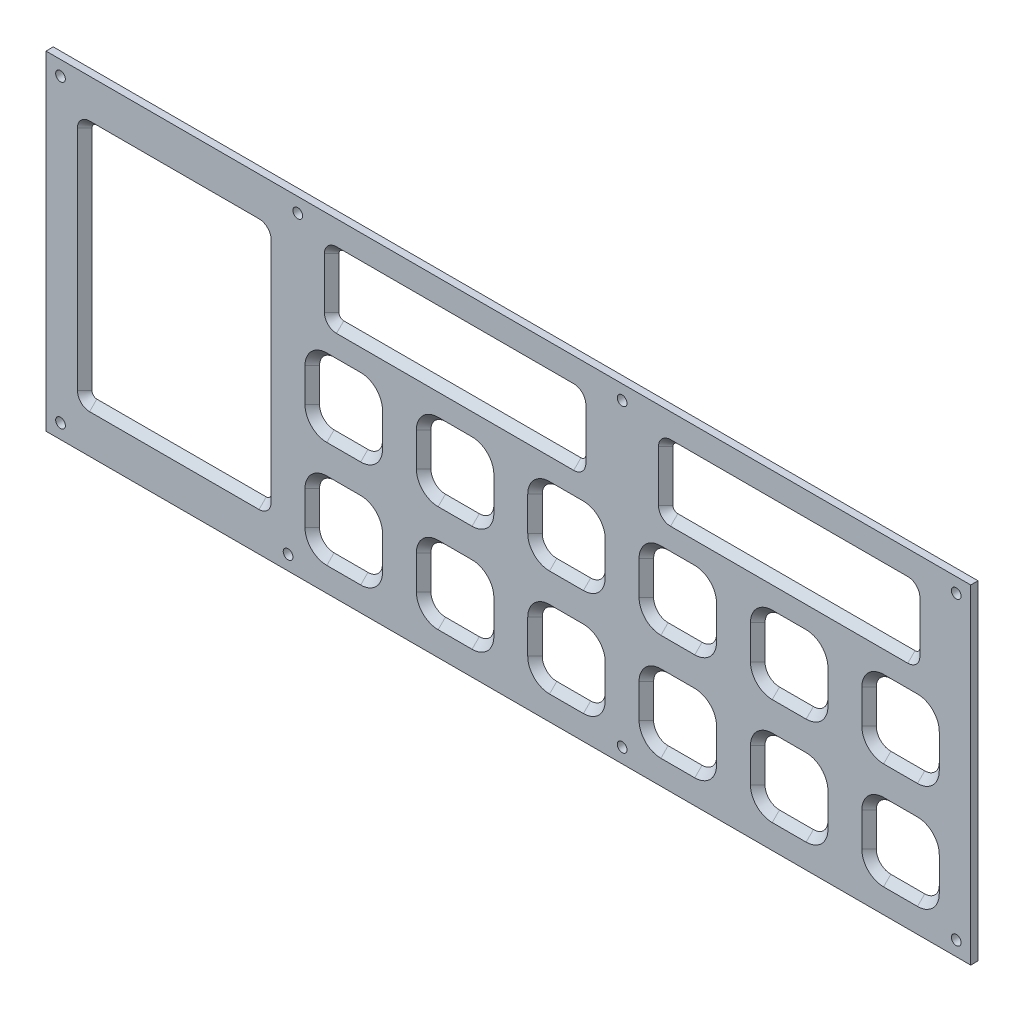
from build123d import *

# Parameters (mm, degrees)
SKETCH1_W                = 191
SKETCH1_H                = 68.005699598
MAIN_PANEL_EXTRUDE_DEPTH = 1.5
CHAMFERS_SIZE            = 1.5
SCREWHOLES_DEPTH         = 203.751141003
SCREWHOLES_DEPTH_BACK    = 203.751141003
SKETCH4_R                = 1


with BuildPart() as part:
    # Sketch1 → Main panel extrude (new body)
    with BuildSketch(Plane.XY):
        with Locations((95.5, 34.002849799)):
            Rectangle(SKETCH1_W, SKETCH1_H)
        with BuildLine():
            Line((9, 58.502849799), (44, 58.502849799))
            ThreePointArc((44, 58.502849799), (44.707106781, 58.20995658), (45, 57.502849799))
            Line((45, 57.502849799), (45, 10.502849799))
            ThreePointArc((45, 10.502849799), (44.707106781, 9.795743018), (44, 9.502849799))
            Line((44, 9.502849799), (9, 9.502849799))
            ThreePointArc((9, 9.502849799), (8.292893219, 9.795743018), (8, 10.502849799))
            Line((8, 10.502849799), (8, 57.502849799))
            ThreePointArc((8, 57.502849799), (8.292893219, 58.20995658), (9, 58.502849799))
        make_face(mode=Mode.SUBTRACT)
        with BuildLine():
            Line((58, 41.502849799), (65, 41.502849799))
            ThreePointArc((65, 41.502849799), (67.121320344, 40.624170143), (68, 38.502849799))
            Line((68, 38.502849799), (68, 31.502849799))
            ThreePointArc((68, 31.502849799), (67.121320344, 29.381529456), (65, 28.502849799))
            Line((65, 28.502849799), (58, 28.502849799))
            ThreePointArc((58, 28.502849799), (55.878679656, 29.381529456), (55, 31.502849799))
            Line((55, 31.502849799), (55, 38.502849799))
            ThreePointArc((55, 38.502849799), (55.878679656, 40.624170143), (58, 41.502849799))
        make_face(mode=Mode.SUBTRACT)
        with BuildLine():
            Line((60, 61.502849799), (109, 61.502849799))
            ThreePointArc((109, 61.502849799), (109.707106781, 61.20995658), (110, 60.502849799))
            Line((110, 60.502849799), (110, 50.002849799))
            ThreePointArc((110, 50.002849799), (109.707106781, 49.295743018), (109, 49.002849799))
            Line((109, 49.002849799), (60, 49.002849799))
            ThreePointArc((60, 49.002849799), (59.292893219, 49.295743018), (59, 50.002849799))
            Line((59, 50.002849799), (59, 60.502849799))
            ThreePointArc((59, 60.502849799), (59.292893219, 61.20995658), (60, 61.502849799))
        make_face(mode=Mode.SUBTRACT)
        with BuildLine():
            Line((81, 41.502849799), (88, 41.502849799))
            ThreePointArc((88, 41.502849799), (90.121320344, 40.624170143), (91, 38.502849799))
            Line((91, 38.502849799), (91, 31.502849799))
            ThreePointArc((91, 31.502849799), (90.121320344, 29.381529456), (88, 28.502849799))
            Line((88, 28.502849799), (81, 28.502849799))
            ThreePointArc((81, 28.502849799), (78.878679656, 29.381529456), (78, 31.502849799))
            Line((78, 31.502849799), (78, 38.502849799))
            ThreePointArc((78, 38.502849799), (78.878679656, 40.624170143), (81, 41.502849799))
        make_face(mode=Mode.SUBTRACT)
        with BuildLine():
            Line((58, 19.502849799), (65, 19.502849799))
            ThreePointArc((65, 19.502849799), (67.121320344, 18.624170143), (68, 16.502849799))
            Line((68, 16.502849799), (68, 9.502849799))
            ThreePointArc((68, 9.502849799), (67.121320344, 7.381529456), (65, 6.502849799))
            Line((65, 6.502849799), (58, 6.502849799))
            ThreePointArc((58, 6.502849799), (55.878679656, 7.381529456), (55, 9.502849799))
            Line((55, 9.502849799), (55, 16.502849799))
            ThreePointArc((55, 16.502849799), (55.878679656, 18.624170143), (58, 19.502849799))
        make_face(mode=Mode.SUBTRACT)
        with BuildLine():
            Line((81, 19.502849799), (88, 19.502849799))
            ThreePointArc((88, 19.502849799), (90.121320344, 18.624170143), (91, 16.502849799))
            Line((91, 16.502849799), (91, 9.502849799))
            ThreePointArc((91, 9.502849799), (90.121320344, 7.381529456), (88, 6.502849799))
            Line((88, 6.502849799), (81, 6.502849799))
            ThreePointArc((81, 6.502849799), (78.878679656, 7.381529456), (78, 9.502849799))
            Line((78, 9.502849799), (78, 16.502849799))
            ThreePointArc((78, 16.502849799), (78.878679656, 18.624170143), (81, 19.502849799))
        make_face(mode=Mode.SUBTRACT)
        with BuildLine():
            Line((104, 41.502849799), (111, 41.502849799))
            ThreePointArc((111, 41.502849799), (113.121320344, 40.624170143), (114, 38.502849799))
            Line((114, 38.502849799), (114, 31.502849799))
            ThreePointArc((114, 31.502849799), (113.121320344, 29.381529456), (111, 28.502849799))
            Line((111, 28.502849799), (104, 28.502849799))
            ThreePointArc((104, 28.502849799), (101.878679656, 29.381529456), (101, 31.502849799))
            Line((101, 31.502849799), (101, 38.502849799))
            ThreePointArc((101, 38.502849799), (101.878679656, 40.624170143), (104, 41.502849799))
        make_face(mode=Mode.SUBTRACT)
        with BuildLine():
            Line((104, 19.502849799), (111, 19.502849799))
            ThreePointArc((111, 19.502849799), (113.121320344, 18.624170143), (114, 16.502849799))
            Line((114, 16.502849799), (114, 9.502849799))
            ThreePointArc((114, 9.502849799), (113.121320344, 7.381529456), (111, 6.502849799))
            Line((111, 6.502849799), (104, 6.502849799))
            ThreePointArc((104, 6.502849799), (101.878679656, 7.381529456), (101, 9.502849799))
            Line((101, 9.502849799), (101, 16.502849799))
            ThreePointArc((101, 16.502849799), (101.878679656, 18.624170143), (104, 19.502849799))
        make_face(mode=Mode.SUBTRACT)
        with BuildLine():
            Line((127, 41.502849799), (134, 41.502849799))
            ThreePointArc((134, 41.502849799), (136.121320344, 40.624170143), (137, 38.502849799))
            Line((137, 38.502849799), (137, 31.502849799))
            ThreePointArc((137, 31.502849799), (136.121320344, 29.381529456), (134, 28.502849799))
            Line((134, 28.502849799), (127, 28.502849799))
            ThreePointArc((127, 28.502849799), (124.878679656, 29.381529456), (124, 31.502849799))
            Line((124, 31.502849799), (124, 38.502849799))
            ThreePointArc((124, 38.502849799), (124.878679656, 40.624170143), (127, 41.502849799))
        make_face(mode=Mode.SUBTRACT)
        with BuildLine():
            Line((129, 61.502849799), (178, 61.502849799))
            ThreePointArc((178, 61.502849799), (178.707106781, 61.20995658), (179, 60.502849799))
            Line((179, 60.502849799), (179, 50.002849799))
            ThreePointArc((179, 50.002849799), (178.707106781, 49.295743018), (178, 49.002849799))
            Line((178, 49.002849799), (129, 49.002849799))
            ThreePointArc((129, 49.002849799), (128.292893219, 49.295743018), (128, 50.002849799))
            Line((128, 50.002849799), (128, 60.502849799))
            ThreePointArc((128, 60.502849799), (128.292893219, 61.20995658), (129, 61.502849799))
        make_face(mode=Mode.SUBTRACT)
        with BuildLine():
            Line((150, 41.502849799), (157, 41.502849799))
            ThreePointArc((157, 41.502849799), (159.121320344, 40.624170143), (160, 38.502849799))
            Line((160, 38.502849799), (160, 31.502849799))
            ThreePointArc((160, 31.502849799), (159.121320344, 29.381529456), (157, 28.502849799))
            Line((157, 28.502849799), (150, 28.502849799))
            ThreePointArc((150, 28.502849799), (147.878679656, 29.381529456), (147, 31.502849799))
            Line((147, 31.502849799), (147, 38.502849799))
            ThreePointArc((147, 38.502849799), (147.878679656, 40.624170143), (150, 41.502849799))
        make_face(mode=Mode.SUBTRACT)
        with BuildLine():
            Line((127, 19.502849799), (134, 19.502849799))
            ThreePointArc((134, 19.502849799), (136.121320344, 18.624170143), (137, 16.502849799))
            Line((137, 16.502849799), (137, 9.502849799))
            ThreePointArc((137, 9.502849799), (136.121320344, 7.381529456), (134, 6.502849799))
            Line((134, 6.502849799), (127, 6.502849799))
            ThreePointArc((127, 6.502849799), (124.878679656, 7.381529456), (124, 9.502849799))
            Line((124, 9.502849799), (124, 16.502849799))
            ThreePointArc((124, 16.502849799), (124.878679656, 18.624170143), (127, 19.502849799))
        make_face(mode=Mode.SUBTRACT)
        with BuildLine():
            Line((150, 19.502849799), (157, 19.502849799))
            ThreePointArc((157, 19.502849799), (159.121320344, 18.624170143), (160, 16.502849799))
            Line((160, 16.502849799), (160, 9.502849799))
            ThreePointArc((160, 9.502849799), (159.121320344, 7.381529456), (157, 6.502849799))
            Line((157, 6.502849799), (150, 6.502849799))
            ThreePointArc((150, 6.502849799), (147.878679656, 7.381529456), (147, 9.502849799))
            Line((147, 9.502849799), (147, 16.502849799))
            ThreePointArc((147, 16.502849799), (147.878679656, 18.624170143), (150, 19.502849799))
        make_face(mode=Mode.SUBTRACT)
        with BuildLine():
            Line((173, 41.502849799), (180, 41.502849799))
            ThreePointArc((180, 41.502849799), (182.121320344, 40.624170143), (183, 38.502849799))
            Line((183, 38.502849799), (183, 31.502849799))
            ThreePointArc((183, 31.502849799), (182.121320344, 29.381529456), (180, 28.502849799))
            Line((180, 28.502849799), (173, 28.502849799))
            ThreePointArc((173, 28.502849799), (170.878679656, 29.381529456), (170, 31.502849799))
            Line((170, 31.502849799), (170, 38.502849799))
            ThreePointArc((170, 38.502849799), (170.878679656, 40.624170143), (173, 41.502849799))
        make_face(mode=Mode.SUBTRACT)
        with BuildLine():
            Line((173, 19.502849799), (180, 19.502849799))
            ThreePointArc((180, 19.502849799), (182.121320344, 18.624170143), (183, 16.502849799))
            Line((183, 16.502849799), (183, 9.502849799))
            ThreePointArc((183, 9.502849799), (182.121320344, 7.381529456), (180, 6.502849799))
            Line((180, 6.502849799), (173, 6.502849799))
            ThreePointArc((173, 6.502849799), (170.878679656, 7.381529456), (170, 9.502849799))
            Line((170, 9.502849799), (170, 16.502849799))
            ThreePointArc((170, 16.502849799), (170.878679656, 18.624170143), (173, 19.502849799))
        make_face(mode=Mode.SUBTRACT)
    extrude(amount=MAIN_PANEL_EXTRUDE_DEPTH)

    # Chamfers
    chamfers_edges = [part.edges().sort_by_distance(p)[0] for p in [
        (183, 13.002849799, 1.5),
        (182.121320344, 18.624170143, 1.5),
        (182.121320344, 7.381529456, 1.5),
        (176.5, 19.502849799, 1.5),
        (176.5, 6.502849799, 1.5),
        (170.878679656, 18.624170143, 1.5),
        (170.878679656, 7.381529456, 1.5),
        (170, 13.002849799, 1.5),
        (160, 13.002849799, 1.5),
        (159.121320344, 18.624170143, 1.5),
        (159.121320344, 7.381529456, 1.5),
        (153.5, 19.502849799, 1.5),
        (153.5, 6.502849799, 1.5),
        (147.878679656, 18.624170143, 1.5),
        (147.878679656, 7.381529456, 1.5),
        (147, 13.002849799, 1.5),
        (160, 35.002849799, 1.5),
        (159.121320344, 40.624170143, 1.5),
        (159.121320344, 29.381529456, 1.5),
        (153.5, 41.502849799, 1.5),
        (153.5, 28.502849799, 1.5),
        (147.878679656, 40.624170143, 1.5),
        (147.878679656, 29.381529456, 1.5),
        (147, 35.002849799, 1.5),
        (183, 35.002849799, 1.5),
        (182.121320344, 40.624170143, 1.5),
        (182.121320344, 29.381529456, 1.5),
        (176.5, 41.502849799, 1.5),
        (176.5, 28.502849799, 1.5),
        (170.878679656, 40.624170143, 1.5),
        (170.878679656, 29.381529456, 1.5),
        (170, 35.002849799, 1.5),
        (179, 55.252849799, 1.5),
        (178.707106781, 61.20995658, 1.5),
        (178.707106781, 49.295743018, 1.5),
        (153.5, 61.502849799, 1.5),
        (153.5, 49.002849799, 1.5),
        (128.292893219, 61.20995658, 1.5),
        (128.292893219, 49.295743018, 1.5),
        (128, 55.252849799, 1.5),
        (137, 13.002849799, 1.5),
        (136.121320344, 18.624170143, 1.5),
        (136.121320344, 7.381529456, 1.5),
        (130.5, 19.502849799, 1.5),
        (130.5, 6.502849799, 1.5),
        (124.878679656, 18.624170143, 1.5),
        (124.878679656, 7.381529456, 1.5),
        (124, 13.002849799, 1.5),
        (137, 35.002849799, 1.5),
        (136.121320344, 40.624170143, 1.5),
        (136.121320344, 29.381529456, 1.5),
        (130.5, 41.502849799, 1.5),
        (130.5, 28.502849799, 1.5),
        (124.878679656, 40.624170143, 1.5),
        (124.878679656, 29.381529456, 1.5),
        (124, 35.002849799, 1.5),
        (114, 13.002849799, 1.5),
        (113.121320344, 18.624170143, 1.5),
        (113.121320344, 7.381529456, 1.5),
        (107.5, 19.502849799, 1.5),
        (107.5, 6.502849799, 1.5),
        (101.878679656, 18.624170143, 1.5),
        (101.878679656, 7.381529456, 1.5),
        (101, 13.002849799, 1.5),
        (114, 35.002849799, 1.5),
        (113.121320344, 40.624170143, 1.5),
        (113.121320344, 29.381529456, 1.5),
        (107.5, 41.502849799, 1.5),
        (107.5, 28.502849799, 1.5),
        (101.878679656, 40.624170143, 1.5),
        (101.878679656, 29.381529456, 1.5),
        (101, 35.002849799, 1.5),
        (91, 13.002849799, 1.5),
        (90.121320344, 18.624170143, 1.5),
        (90.121320344, 7.381529456, 1.5),
        (84.5, 19.502849799, 1.5),
        (84.5, 6.502849799, 1.5),
        (78.878679656, 18.624170143, 1.5),
        (78.878679656, 7.381529456, 1.5),
        (78, 13.002849799, 1.5),
        (91, 35.002849799, 1.5),
        (90.121320344, 40.624170143, 1.5),
        (90.121320344, 29.381529456, 1.5),
        (84.5, 41.502849799, 1.5),
        (84.5, 28.502849799, 1.5),
        (78.878679656, 40.624170143, 1.5),
        (78.878679656, 29.381529456, 1.5),
        (78, 35.002849799, 1.5),
        (110, 55.252849799, 1.5),
        (109.707106781, 61.20995658, 1.5),
        (109.707106781, 49.295743018, 1.5),
        (84.5, 61.502849799, 1.5),
        (84.5, 49.002849799, 1.5),
        (59.292893219, 61.20995658, 1.5),
        (59.292893219, 49.295743018, 1.5),
        (59, 55.252849799, 1.5),
        (68, 13.002849799, 1.5),
        (67.121320344, 18.624170143, 1.5),
        (67.121320344, 7.381529456, 1.5),
        (61.5, 19.502849799, 1.5),
        (61.5, 6.502849799, 1.5),
        (55.878679656, 18.624170143, 1.5),
        (55.878679656, 7.381529456, 1.5),
        (55, 13.002849799, 1.5),
        (68, 35.002849799, 1.5),
        (67.121320344, 40.624170143, 1.5),
        (67.121320344, 29.381529456, 1.5),
        (61.5, 41.502849799, 1.5),
        (61.5, 28.502849799, 1.5),
        (55.878679656, 40.624170143, 1.5),
        (55.878679656, 29.381529456, 1.5),
        (55, 35.002849799, 1.5),
        (45, 34.002849799, 1.5),
        (44.707106781, 58.20995658, 1.5),
        (44.707106781, 9.795743018, 1.5),
        (26.5, 58.502849799, 1.5),
        (26.5, 9.502849799, 1.5),
        (8.292893219, 58.20995658, 1.5),
        (8.292893219, 9.795743018, 1.5),
        (8, 34.002849799, 1.5),
    ]]
    chamfer(chamfers_edges, length=CHAMFERS_SIZE - 0.0001)  # a hair under: the kernel refuses the full size

    # Sketch4 → Screwholes (cut, two sides: drawn at the far end of the back side and taken through both)
    with BuildSketch(Plane.XY.offset(1.5).offset(-SCREWHOLES_DEPTH_BACK)):
        with Locations((3, 3)):
            Circle(SKETCH4_R)
        with Locations((50, 3)):
            Circle(SKETCH4_R)
        with Locations((3, 65.005699598)):
            Circle(SKETCH4_R)
        with Locations((119, 3)):
            Circle(SKETCH4_R)
        with Locations((188, 3)):
            Circle(SKETCH4_R)
        with Locations((188, 65.005699598)):
            Circle(SKETCH4_R)
        with Locations((119, 65.005699598)):
            Circle(SKETCH4_R)
        with Locations((52, 65.005699598)):
            Circle(SKETCH4_R)
    extrude(amount=SCREWHOLES_DEPTH + SCREWHOLES_DEPTH_BACK, mode=Mode.SUBTRACT)


solid = part.part
